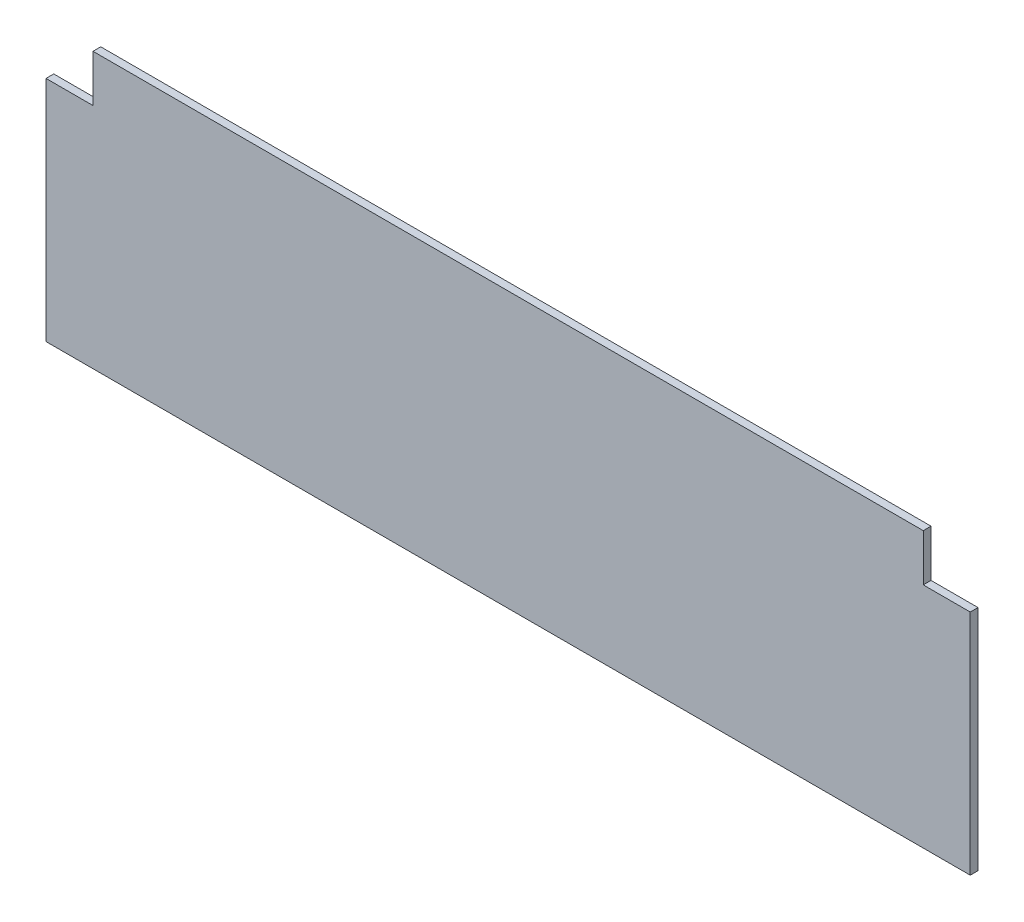
from build123d import *

# Parameters (mm, degrees)
BOSS_EXTRUDE1_DEPTH = 3.3


with BuildPart() as part:
    # Sketch1 → Boss-Extrude1 (new body)
    with BuildSketch(Plane.XY):
        Polygon((0, -136.821866811), (393.4, -136.821866811), (393.4, -39.804293747), (373.4, -39.804293747), (373.4, -19.804293747), (20, -19.804293747), (20, -39.804293747), (0, -39.804293747), align=None)
    extrude(amount=-BOSS_EXTRUDE1_DEPTH)


solid = part.part
